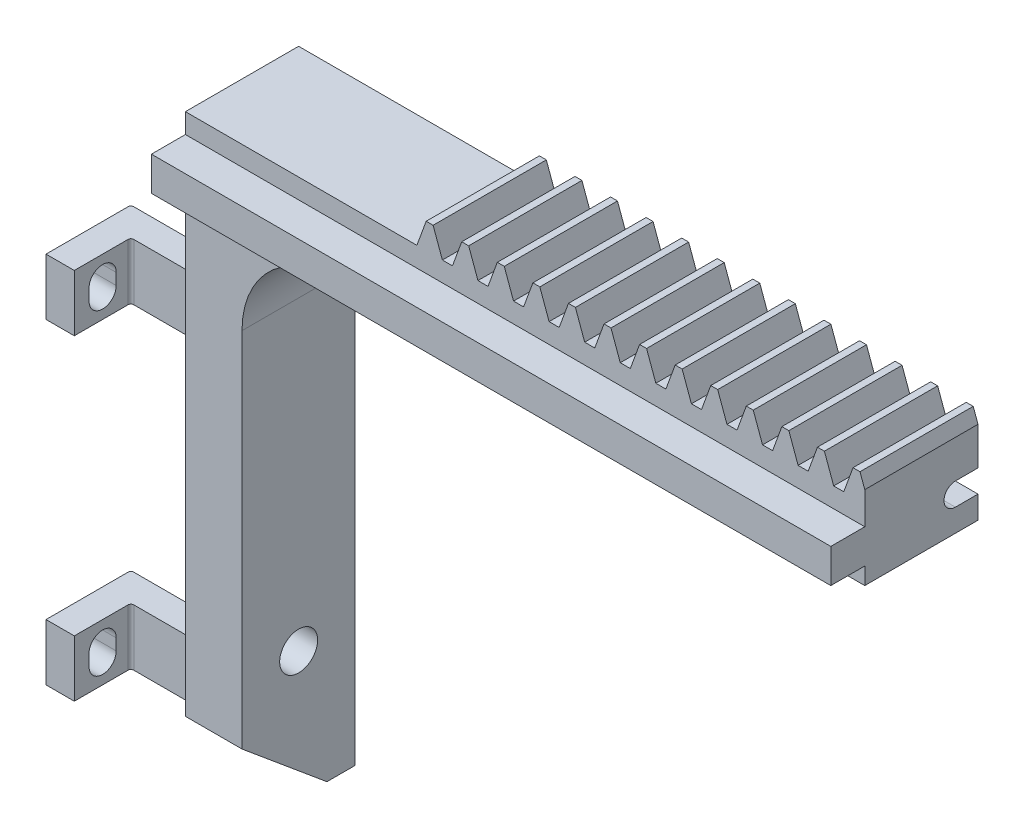
from build123d import *

# Parameters (mm, degrees)
BLANKSKE_W               = 40
BLANKSKE_H               = 8.5
BLANK_DEPTH              = 10
TOOTHCUTSIM_DEPTH        = 43.09809972
TEETHCUTS_COUNT          = 14
TEETHCUTS_PITCH          = 3.14159265
BOSS_EXTRUDE1_DEPTH      = 10
SKETCH2_W                = 3
SKETCH2_H                = 3
BOSS_EXTRUDE2_DEPTH      = 60
CUT_EXTRUDE2_DEPTH       = 73.801098893
MOVE_FACE2_BY            = 5
FILLET2_R                = 8
SKETCH3_R                = 1.675
CUT_EXTRUDE1_DEPTH       = 69.738635424
SKETCH6_W                = 14.81
SKETCH6_H                = 5
BOSS_EXTRUDE3_DEPTH      = 2.5
SKETCH7_W                = 2.5
SKETCH7_H                = 5
BOSS_EXTRUDE4_DEPTH      = 5
M2_START                 = -34.81
M2_CLEARANCE_SLOT1_DEPTH = 2.5
BOSS_EXTRUDE5_DEPTH      = 5
FILLET3_R                = 5
FILLET4_R                = 1
FILLET5_R                = 0.25


with BuildPart() as part:
    # BlankSke → Blank (new body)
    with BuildSketch(Plane.XY):
        with Locations((20, 4.25)):
            Rectangle(BLANKSKE_W, BLANKSKE_H)
    extrude(amount=-BLANK_DEPTH)

    # TooCutSkeSim → ToothCutSim (cut, through all)
    with BuildSketch(Plane.XY):
        Polygon((0.44443537, 6.25), (-0.44443537, 6.25), (-1.272613241, 8.5254), (1.272613241, 8.5254), align=None)
    toothcutsim = extrude(amount=-TOOTHCUTSIM_DEPTH, mode=Mode.SUBTRACT)

    # TeethCuts: ToothCutSim ×14
    with Locations(*[(i * TEETHCUTS_PITCH, 0, 0) for i in range(1, TEETHCUTS_COUNT)]):
        add(toothcutsim, mode=Mode.SUBTRACT)

    # Sketch1 → Boss-Extrude1 (add)
    with BuildSketch(Plane.XY):
        Polygon((-20, 0), (-20, -40), (-10, -40), (-10, 0), (0, 0), (0, 6.25), (-20, 6.25), align=None)
    extrude(amount=-BOSS_EXTRUDE1_DEPTH)

    # Sketch2 → Boss-Extrude2 (add)
    with BuildSketch(Plane(origin=(40, 0, 0), x_dir=(0, 0, -1), z_dir=(1, 0, 0))):
        with Locations((-1.5, 3)):
            Rectangle(SKETCH2_W, SKETCH2_H)
    extrude(amount=-BOSS_EXTRUDE2_DEPTH)

    # Sketch5 → Cut-Extrude2 (cut, through all)
    with BuildSketch(Plane(origin=(40, 0, 0), x_dir=(0, 0, -1), z_dir=(1, 0, 0))):
        with BuildLine():
            Line((10, 2), (10, 4))
            Line((10, 4), (8, 4))
            ThreePointArc((8, 4), (7, 3), (8, 2))
            Line((8, 2), (10, 2))
        make_face()
    extrude(amount=-CUT_EXTRUDE2_DEPTH, mode=Mode.SUBTRACT)

    # Move Face2: a face moved inward by 5.0
    extrude(part.faces().sort_by_distance((-10, -20, -5))[0], amount=MOVE_FACE2_BY, dir=(-1, 0, 0), mode=Mode.SUBTRACT)

    # Fillet2
    fillet2_edges = [part.edges().sort_by_distance(p)[0] for p in [
        (-15, 0, -5),
    ]]
    fillet(fillet2_edges, radius=FILLET2_R)

    # Sketch3 → Cut-Extrude1 (cut, through all)
    with BuildSketch(Plane.ZY.offset(15)):
        with Locations((-5, -35)):
            Circle(SKETCH3_R)
    extrude(amount=CUT_EXTRUDE1_DEPTH, mode=Mode.SUBTRACT)

    # Sketch6 → Boss-Extrude3 (add)
    with BuildSketch(Plane(origin=(0, 0, -10), x_dir=(-1, 0, 0), z_dir=(0, 0, -1))):
        with Locations((27.405, -15.8)):
            Rectangle(SKETCH6_W, SKETCH6_H)
        Polygon((20, -40), (15, -40), (15, -46.25), (34.81, -46.25), (34.81, -41.25), (20, -41.25), align=None)
    extrude(amount=-BOSS_EXTRUDE3_DEPTH)

    # Sketch7 → Boss-Extrude4 (add)
    with BuildSketch(Plane.XY.offset(-7.5)):
        with Locations((-33.56, -15.8)):
            Rectangle(SKETCH7_W, SKETCH7_H)
        with Locations((-33.56, -43.75)):
            Rectangle(SKETCH7_W, SKETCH7_H)
    extrude(amount=BOSS_EXTRUDE4_DEPTH)

    # M2 Clearance Slot1: read off the stored shape, not the designer's step
    # M2 Clearance Slot1 outline → M2 Clearance Slot1 (cut)
    with BuildSketch(Plane.YZ.offset(M2_START)):
        with BuildLine():
            ThreePointArc((-44.25, -3.8), (-45.45, -5), (-44.25, -6.2))
            Line((-44.25, -6.2), (-43.25, -6.2))
            ThreePointArc((-43.25, -6.2), (-42.05, -5), (-43.25, -3.8))
            Line((-43.25, -3.8), (-44.25, -3.8))
        make_face()
        with BuildLine():
            ThreePointArc((-16.3, -3.8), (-17.5, -5), (-16.3, -6.2))
            Line((-16.3, -6.2), (-15.3, -6.2))
            ThreePointArc((-15.3, -6.2), (-14.1, -5), (-15.3, -3.8))
            Line((-15.3, -3.8), (-16.3, -3.8))
        make_face()
    extrude(amount=M2_CLEARANCE_SLOT1_DEPTH, mode=Mode.SUBTRACT)

    # M2 Clearance Slot1 2: loft between two sections, ruled curve by curve
    m2_clearance_slot1_2_from = [
        Edge.make_three_point_arc((-34.785, -43.25, -3.8), (-34.785, -42.401471863, -4.151471863), (-34.785, -42.05, -5)),
        Edge.make_three_point_arc((-34.785, -42.05, -5), (-34.785, -42.401471863, -5.848528137), (-34.785, -43.25, -6.2)),
        Edge.make_three_point_arc((-34.785, -44.25, -6.2), (-34.785, -45.098528137, -5.848528137), (-34.785, -45.45, -5)),
        Edge.make_three_point_arc((-34.785, -45.45, -5), (-34.785, -45.098528137, -4.151471863), (-34.785, -44.25, -3.8)),
        Edge.make_line((-34.785, -43.25, -6.2), (-34.785, -44.25, -6.2)),
        Edge.make_line((-34.785, -43.25, -3.8), (-34.785, -44.25, -3.8)),
    ]
    m2_clearance_slot1_2_to = [
        Edge.make_three_point_arc((-34.81, -43.25, -3.775), (-34.81, -42.383794193, -4.133794193), (-34.81, -42.025, -5)),
        Edge.make_three_point_arc((-34.81, -42.025, -5), (-34.81, -42.383794193, -5.866205807), (-34.81, -43.25, -6.225)),
        Edge.make_three_point_arc((-34.81, -44.25, -6.225), (-34.81, -45.116205807, -5.866205807), (-34.81, -45.475, -5)),
        Edge.make_three_point_arc((-34.81, -45.475, -5), (-34.81, -45.116205807, -4.133794193), (-34.81, -44.25, -3.775)),
        Edge.make_line((-34.81, -43.25, -6.225), (-34.81, -44.25, -6.225)),
        Edge.make_line((-34.81, -43.25, -3.775), (-34.81, -44.25, -3.775)),
    ]
    m2_clearance_slot1_2 = Solid(Shell([*[Face.make_surface_from_curves(m2_clearance_slot1_2_from[k], m2_clearance_slot1_2_to[k]) for k in range(6)], Face(Wire(m2_clearance_slot1_2_from)), Face(Wire(m2_clearance_slot1_2_to))]))
    add(m2_clearance_slot1_2, mode=Mode.SUBTRACT)

    # M2 Clearance Slot1 3: loft between two sections, ruled curve by curve
    m2_clearance_slot1_3_from = [
        Edge.make_three_point_arc((-34.785, -15.3, -3.8), (-34.785, -14.451471863, -4.151471863), (-34.785, -14.1, -5)),
        Edge.make_three_point_arc((-34.785, -14.1, -5), (-34.785, -14.451471863, -5.848528137), (-34.785, -15.3, -6.2)),
        Edge.make_three_point_arc((-34.785, -16.3, -6.2), (-34.785, -17.148528137, -5.848528137), (-34.785, -17.5, -5)),
        Edge.make_three_point_arc((-34.785, -17.5, -5), (-34.785, -17.148528137, -4.151471863), (-34.785, -16.3, -3.8)),
        Edge.make_line((-34.785, -15.3, -6.2), (-34.785, -16.3, -6.2)),
        Edge.make_line((-34.785, -15.3, -3.8), (-34.785, -16.3, -3.8)),
    ]
    m2_clearance_slot1_3_to = [
        Edge.make_three_point_arc((-34.81, -15.3, -3.775), (-34.81, -14.433794193, -4.133794193), (-34.81, -14.075, -5)),
        Edge.make_three_point_arc((-34.81, -14.075, -5), (-34.81, -14.433794193, -5.866205807), (-34.81, -15.3, -6.225)),
        Edge.make_three_point_arc((-34.81, -16.3, -6.225), (-34.81, -17.166205807, -5.866205807), (-34.81, -17.525, -5)),
        Edge.make_three_point_arc((-34.81, -17.525, -5), (-34.81, -17.166205807, -4.133794193), (-34.81, -16.3, -3.775)),
        Edge.make_line((-34.81, -15.3, -6.225), (-34.81, -16.3, -6.225)),
        Edge.make_line((-34.81, -15.3, -3.775), (-34.81, -16.3, -3.775)),
    ]
    m2_clearance_slot1_3 = Solid(Shell([*[Face.make_surface_from_curves(m2_clearance_slot1_3_from[k], m2_clearance_slot1_3_to[k]) for k in range(6)], Face(Wire(m2_clearance_slot1_3_from)), Face(Wire(m2_clearance_slot1_3_to))]))
    add(m2_clearance_slot1_3, mode=Mode.SUBTRACT)

    # Sketch10 → Boss-Extrude5 (add)
    with BuildSketch(Plane(origin=(-15, 0, 0), x_dir=(0, 0, -1), z_dir=(1, 0, 0))):
        Polygon((7.5, -46.25), (0, -40), (7.5, -40), align=None)
    extrude(amount=-BOSS_EXTRUDE5_DEPTH)

    # Fillet3
    fillet3_edges = [part.edges().sort_by_distance(p)[0] for p in [
        (-20, -15.8, -7.5),
        (-20, -43.75, -7.5),
    ]]
    fillet(fillet3_edges, radius=FILLET3_R)

    # Fillet4
    fillet4_edges = [part.edges().sort_by_distance(p)[0] for p in [
        (-20, -18.3, -6.25),
        (-20, -13.3, -6.25),
        (-20, -41.25, -6.25),
    ]]
    fillet(fillet4_edges, radius=FILLET4_R)

    # Fillet5
    fillet5_edges = [part.edges().sort_by_distance(p)[0] for p in [
        (-34.81, -15.8, -10),
        (-34.81, -43.75, -10),
        (-32.31, -15.8, -7.5),
        (-32.31, -43.75, -7.5),
    ]]
    fillet(fillet5_edges, radius=FILLET5_R)


solid = part.part
